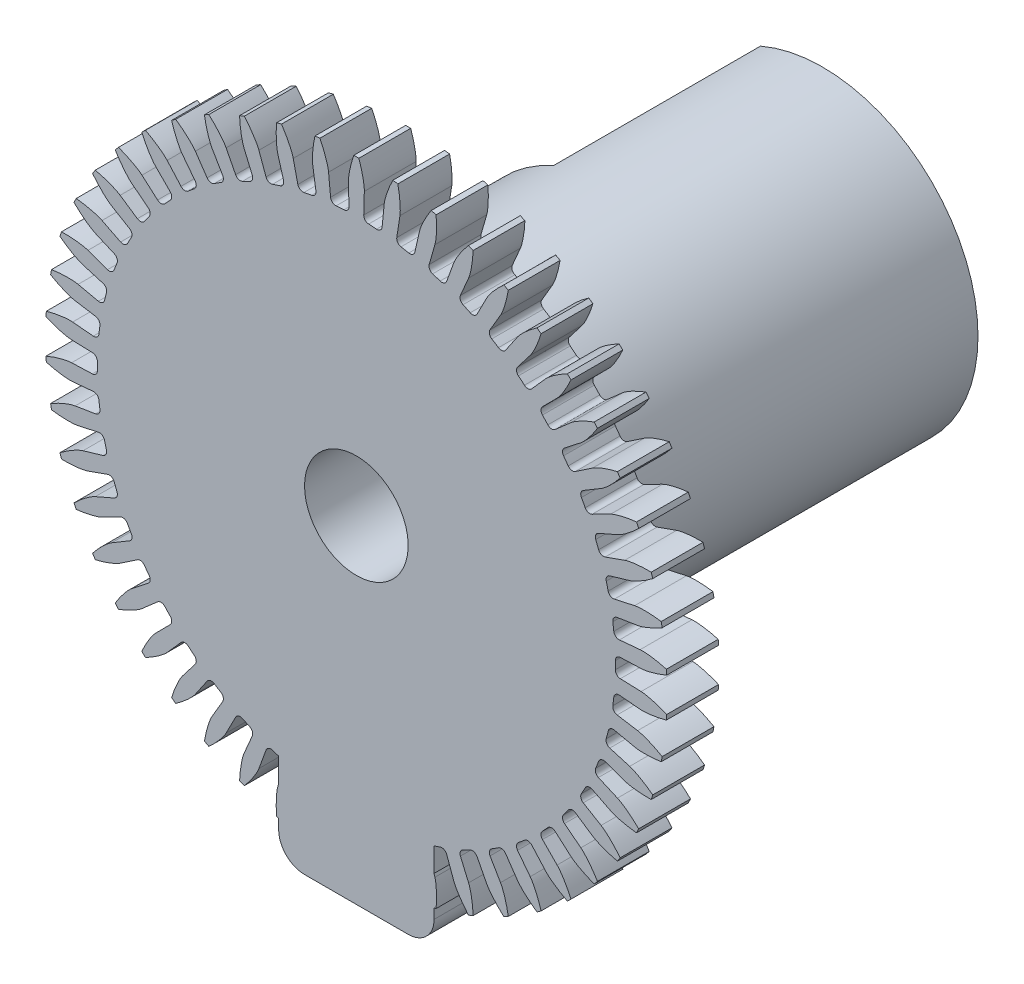
from build123d import *
from build123d.topology import SkipClean

# Parameters (mm, degrees)
SCHIZZO1_R                   = 6
SCHIZZO1_R_2                 = 1
ESTRUSIONE_ESTRUSIONE1_DEPTH = 1
TAGLIO_ESTRUSIONE1_REACH     = 10.544
RIPETIZIONECIRCOLARE1_COUNT  = 50
ESTRUSIONE_ESTRUSIONE2_START = 8
SCHIZZO3_R                   = 3
SCHIZZO3_R_2                 = 1
ESTRUSIONE_ESTRUSIONE2_DEPTH = 8
ESTRUSIONE_ESTRUSIONE3_START = -1
ESTRUSIONE_ESTRUSIONE3_DEPTH = 2.5
TAGLIO_ESTRUSIONE2_DEPTH     = 4
ESTRUSIONE_ESTRUSIONE4_START = -4
SCHIZZO6_R                   = 1
ESTRUSIONE_ESTRUSIONE4_DEPTH = 1


with BuildPart() as part:
    # Schizzo1 → Estrusione-Estrusione1 (new body)
    with BuildSketch(Plane.XY):
        Circle(SCHIZZO1_R)
        Circle(SCHIZZO1_R_2, mode=Mode.SUBTRACT)
    extrude(amount=ESTRUSIONE_ESTRUSIONE1_DEPTH)

    # Schizzo2 → Taglio-Estrusione1 (cut, up to next)
    with BuildSketch(Plane.XY.offset(1), mode=Mode.PRIVATE) as taglio_estrusione1_sk1:
        with BuildLine():
            Line((8.314157972, -2.625050248), (8.314157972, 2.625050248))
            add(Edge.make_bspline(
                [(5.496649549, 0.191947232), (5.502322641, 0.192145341), (5.518215405, 0.193089941), (5.54816736, 0.196410592), (5.596786879, 0.203998752), (5.658272829, 0.216840512), (5.737043192, 0.237053235), (5.828780352, 0.265472856), (5.9282918, 0.301480685), (6.034948126, 0.345738691), (6.139778897, 0.39433292), (6.242747846, 0.446877442), (6.343783317, 0.502853712), (6.464208535, 0.574872467), (6.605787606, 0.667047298), (6.766787792, 0.783023197), (6.943804518, 0.924111954), (7.117744111, 1.077728151), (7.283416222, 1.236846949), (7.444047772, 1.406340067), (7.594636894, 1.576498943), (7.743595548, 1.761627921), (7.877331008, 1.936834332), (8.018443956, 2.14185432), (8.129813224, 2.30991191), (8.237297086, 2.490398222), (8.288480785, 2.579237003), (8.314157972, 2.625050248)],
                knots=[0, 0, 0, 0, 0, 0.005376748, 0.015083688, 0.02853182, 0.046610139, 0.064854849, 0.092110525, 0.119476175, 0.146842495, 0.174208853, 0.201574955, 0.228941013, 0.256307345, 0.307035032, 0.361767351, 0.41649966, 0.471231936, 0.525964281, 0.580696615, 0.635428982, 0.690161387, 0.744893688, 0.799626083, 0.854358409, 0.909090916, 0.909090916, 0.909090916, 0.909090916, 0.909090916], degree=4))
            Line((5.496649549, 0.191947232), (5.095913329, 0.177953215))
            ThreePointArc((5.095913329, 0.177953215), (5.026940081, 0.146927738), (4.999414979, 0.076484443))
            ThreePointArc((4.999414979, 0.076484443), (5, 0), (4.999414979, -0.076484443))
            ThreePointArc((4.999414979, -0.076484443), (5.026940081, -0.146927738), (5.095913329, -0.177953215))
            Line((5.095913329, -0.177953215), (5.496649549, -0.191947232))
            add(Edge.make_bspline(
                [(5.496649549, -0.191947232), (5.502322641, -0.192145341), (5.518215405, -0.193089941), (5.54816736, -0.196410592), (5.596786879, -0.203998752), (5.658272829, -0.216840512), (5.737043192, -0.237053235), (5.828780352, -0.265472856), (5.9282918, -0.301480685), (6.034948126, -0.345738691), (6.139778897, -0.39433292), (6.242747846, -0.446877442), (6.343783317, -0.502853712), (6.464208535, -0.574872467), (6.605787606, -0.667047298), (6.766787792, -0.783023197), (6.943804518, -0.924111954), (7.117744111, -1.077728151), (7.283416222, -1.236846949), (7.444047772, -1.406340067), (7.594636894, -1.576498943), (7.743595548, -1.761627921), (7.877331008, -1.936834331), (8.018443956, -2.14185432), (8.129813224, -2.30991191), (8.237297086, -2.490398222), (8.288480785, -2.579237003), (8.314157972, -2.625050248)],
                knots=[0, 0, 0, 0, 0, 0.005376748, 0.015083688, 0.02853182, 0.046610139, 0.064854849, 0.092110525, 0.119476175, 0.146842495, 0.174208853, 0.201574955, 0.228941013, 0.256307345, 0.307035032, 0.361767351, 0.41649966, 0.471231936, 0.525964281, 0.580696615, 0.635428982, 0.690161387, 0.744893688, 0.799626083, 0.854358409, 0.909090916, 0.909090916, 0.909090916, 0.909090916, 0.909090916], degree=4))
        make_face()
    taglio_estrusione1_tool1 = extrude(taglio_estrusione1_sk1.sketch, amount=-TAGLIO_ESTRUSIONE1_REACH, mode=Mode.PRIVATE) & part.part
    taglio_estrusione1 = taglio_estrusione1_tool1.solids().sort_by_distance((7.372142, 0, 1))[0]
    add(taglio_estrusione1, mode=Mode.SUBTRACT)

    # RipetizioneCircolare1: Taglio-Estrusione1 ×50 about axis
    ripetizionecircolare1_axis = Axis((0, 0, 1), (0, 0, 1))
    for i in range(1, RIPETIZIONECIRCOLARE1_COUNT):
        add(taglio_estrusione1.rotate(ripetizionecircolare1_axis, i * 360 / RIPETIZIONECIRCOLARE1_COUNT), mode=Mode.SUBTRACT)

    # Schizzo3 → Estrusione-Estrusione2 (add)
    with SkipClean():  # the faces are left unmerged after this step: merging them gives an invalid solid
        with BuildSketch(Plane(origin=(0, 0, 0), x_dir=(-1, 0, 0), z_dir=(0, 0, -1)).offset(ESTRUSIONE_ESTRUSIONE2_START)):
            with Locations(Location((0, 0, 0), (0, 0, 180))):
                Circle(SCHIZZO3_R)
            Circle(SCHIZZO3_R_2, mode=Mode.SUBTRACT)
        extrude(amount=-ESTRUSIONE_ESTRUSIONE2_DEPTH)

    # Schizzo4 → Estrusione-Estrusione3 (add)
    with SkipClean():  # the faces are left unmerged after this step: merging them gives an invalid solid
        with BuildSketch(Plane(origin=(0, 0, 0), x_dir=(-1, 0, 0), z_dir=(0, 0, -1)).offset(ESTRUSIONE_ESTRUSIONE3_START)):
            with BuildLine():
                Line((-1, -6.499801152), (1, -6.499801152))
                ThreePointArc((1, -6.499801152), (1.353553391, -6.353354542), (1.5, -5.999801152))
                Line((1.5, -5.999801152), (1.5, -4.499801152))
                Line((1.5, -4.499801152), (-1.5, -4.499801152))
                Line((-1.5, -4.499801152), (-1.5, -5.999801152))
                ThreePointArc((-1.5, -5.999801152), (-1.353553391, -6.353354542), (-1, -6.499801152))
            make_face()
        extrude(amount=ESTRUSIONE_ESTRUSIONE3_DEPTH)

    # Schizzo5 → Taglio-Estrusione2 (cut)
    with SkipClean():  # the faces are left unmerged after this step: merging them gives an invalid solid
        with BuildSketch(Plane(origin=(0, 0, -8), x_dir=(-1, 0, 0), z_dir=(0, 0, -1))):
            with BuildLine():
                Line((1.2, 2.749545417), (1.2, -2.749545417))
                ThreePointArc((1.2, -2.749545417), (3, 0), (1.2, 2.749545417))
            make_face()
        extrude(amount=-TAGLIO_ESTRUSIONE2_DEPTH, mode=Mode.SUBTRACT)

    # Schizzo6 → Estrusione-Estrusione4 (add)
    with SkipClean():  # the faces are left unmerged after this step: merging them gives an invalid solid
        with BuildSketch(Plane.XY.offset(1).offset(ESTRUSIONE_ESTRUSIONE4_START)):
            with Locations(Location((0, 0, 0), (0, 0, 180))):
                Circle(SCHIZZO6_R)
        extrude(amount=ESTRUSIONE_ESTRUSIONE4_DEPTH)


solid = part.part
